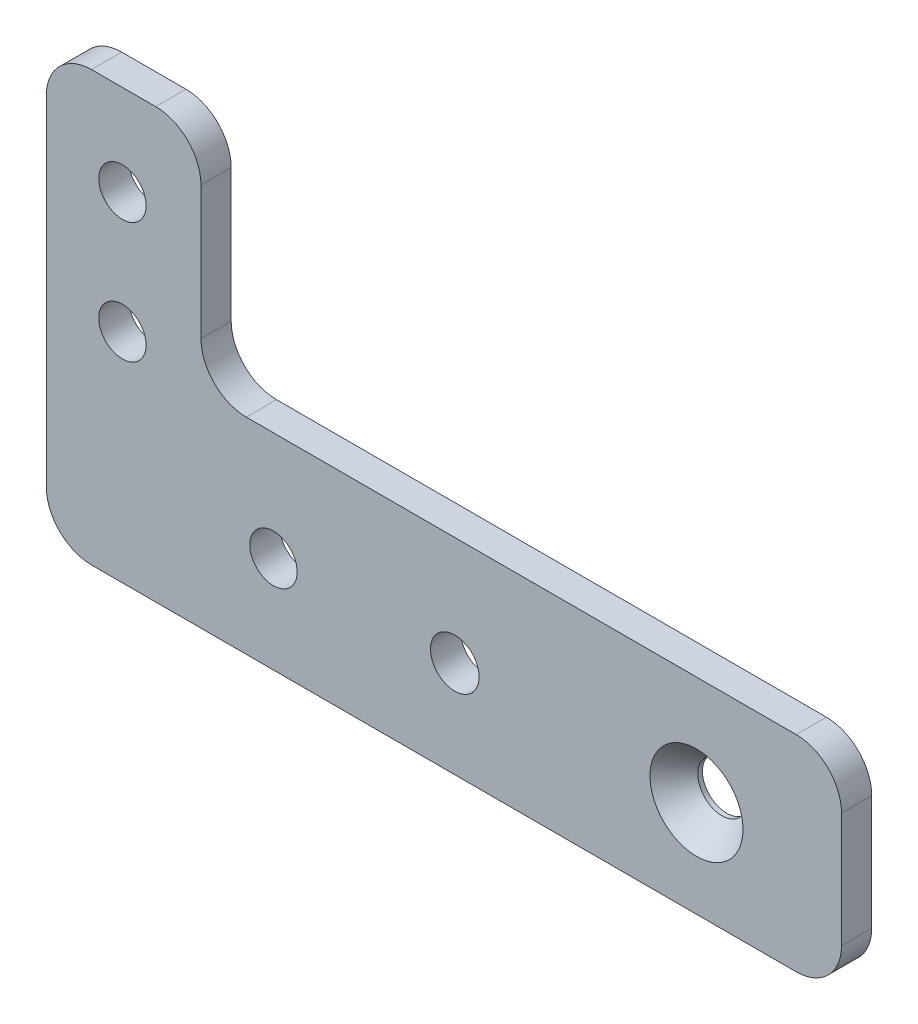
from build123d import *

# Parameters (mm, degrees)
SKETCH1_R                                       = 2.4892
SKETCH1_R_2                                     = 2.5527
BOSS_EXTRUDE1_DEPTH                             = 3.175
FILLET1_R                                       = 4.7625
CSK_FOR_10_FLAT_HEAD_MACHINE_SCREW1_D           = 5.1054
CSK_FOR_10_FLAT_HEAD_MACHINE_SCREW1_DEPTH       = 19.05
CSK_FOR_10_FLAT_HEAD_MACHINE_SCREW1_CSINK_D     = 9.779
CSK_FOR_10_FLAT_HEAD_MACHINE_SCREW1_CSINK_ANGLE = 82
CSK_FOR_10_FLAT_HEAD_MACHINE_SCREW1_TIP         = 1.533816902


with BuildPart() as part:
    # Sketch1 → Boss-Extrude1 (new body)
    with BuildSketch(Plane.XY):
        Polygon((-37.846, 23.8125), (-37.846, -21.2725), (45.72, -21.2725), (45.72, 0.3175), (-21.59, 0.3175), (-21.59, 23.8125), align=None)
        with Locations((-13.97, -11.1125)):
            Circle(SKETCH1_R, mode=Mode.SUBTRACT)
        with Locations((5.08, -11.1125)):
            Circle(SKETCH1_R_2, mode=Mode.SUBTRACT)
        with Locations((30.48, -11.1125)):
            Circle(SKETCH1_R_2, mode=Mode.SUBTRACT)
        with Locations((-29.845, 1.5875)):
            Circle(SKETCH1_R, mode=Mode.SUBTRACT)
        with Locations((-29.845, 14.2875)):
            Circle(SKETCH1_R, mode=Mode.SUBTRACT)
    extrude(amount=BOSS_EXTRUDE1_DEPTH)

    # Fillet1
    fillet1_edges = [part.edges().sort_by_distance(p)[0] for p in [
        (-37.846, 23.8125, 1.5875),
        (-21.59, 23.8125, 1.5875),
        (-21.59, 0.3175, 1.5875),
        (45.72, 0.3175, 1.5875),
        (45.72, -21.2725, 1.5875),
        (-37.846, -21.2725, 1.5875),
    ]]
    fillet(fillet1_edges, radius=FILLET1_R)

    # CSK for #10 Flat Head Machine Screw1
    with Locations(Plane.XY.offset(3.175)):
        with Locations((30.48, -11.1125)):
            CounterSinkHole(CSK_FOR_10_FLAT_HEAD_MACHINE_SCREW1_D / 2, CSK_FOR_10_FLAT_HEAD_MACHINE_SCREW1_CSINK_D / 2, depth=CSK_FOR_10_FLAT_HEAD_MACHINE_SCREW1_DEPTH, counter_sink_angle=CSK_FOR_10_FLAT_HEAD_MACHINE_SCREW1_CSINK_ANGLE)
            with Locations((0, 0, -(CSK_FOR_10_FLAT_HEAD_MACHINE_SCREW1_DEPTH + CSK_FOR_10_FLAT_HEAD_MACHINE_SCREW1_TIP / 2))):  # 118° drill point
                Cone(0, CSK_FOR_10_FLAT_HEAD_MACHINE_SCREW1_D / 2, CSK_FOR_10_FLAT_HEAD_MACHINE_SCREW1_TIP, mode=Mode.SUBTRACT)


solid = part.part
